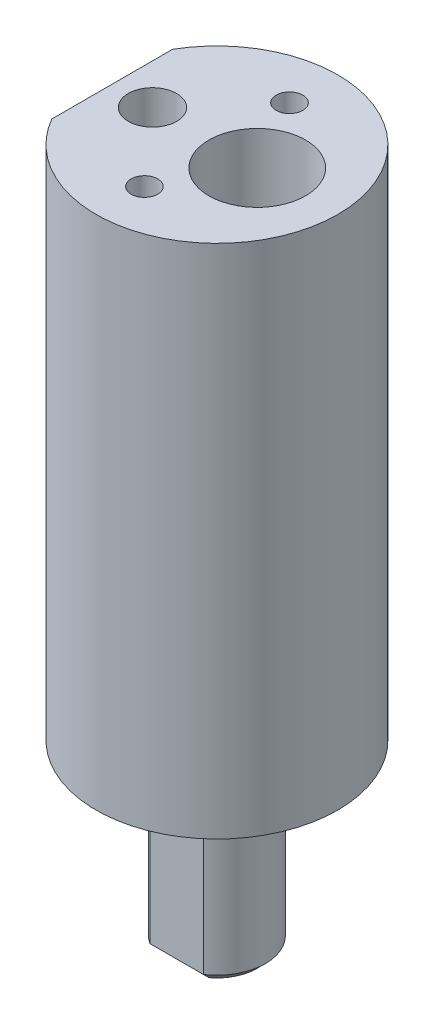
from build123d import *

# Parameters (mm, degrees)
BOSS_EXTRUDE1_DEPTH     = 22
BOSS_EXTRUDE2_DEPTH     = 64
SKETCH3_R               = 3
CUT_EXTRUDE1_DEPTH      = 65
SKETCH4_R               = 6
CUT_EXTRUDE2_DEPTH      = 52
M4_TAPPED_HOLE1_D       = 3.3
M4_TAPPED_HOLE1_DEPTH   = 14
M4_TAPPED_HOLE1_TIP     = 0.991420021
CUT_EXTRUDE3_REACH      = 93.679
CUT_EXTRUDE3_END_RADIUS = 3
SKETCH8_R               = 2.5
SKETCH8_R_2             = 1.5
SKETCH9_R               = 1
CUT_EXTRUDE4_DEPTH      = 15
CHAMFER1_SIZE           = 1


with BuildPart() as part:
    # Sketch1 → Boss-Extrude1 (new body)
    with BuildSketch(Plane(origin=(0, 0, 0), x_dir=(1, 0, 0), z_dir=(0, 1, 0))):
        with BuildLine():
            Line((-3.31662479, -5), (3.31662479, -5))
            ThreePointArc((3.31662479, -5), (0, 6), (-3.31662479, -5))
        make_face()
    extrude(amount=BOSS_EXTRUDE1_DEPTH)

    # Sketch2 → Boss-Extrude2 (add)
    with BuildSketch(Plane(origin=(0, 22, 0), x_dir=(1, 0, 0), z_dir=(0, 1, 0))):
        with BuildLine():
            Line((-13, 7.483314774), (-13, -7.483314774))
            ThreePointArc((-13, -7.483314774), (15, 0), (-13, 7.483314774))
        make_face()
    extrude(amount=BOSS_EXTRUDE2_DEPTH)

    # Sketch3 → Cut-Extrude1 (cut)
    with BuildSketch(Plane(origin=(0, 86, 0), x_dir=(1, 0, 0), z_dir=(0, 1, 0))):
        with Locations(Location((-8, 0, 0), (0, 0, 270))):
            Circle(SKETCH3_R)
    extrude(amount=-CUT_EXTRUDE1_DEPTH, mode=Mode.SUBTRACT)

    # Sketch4 → Cut-Extrude2 (cut)
    with BuildSketch(Plane(origin=(0, 86, 0), x_dir=(1, 0, 0), z_dir=(0, 1, 0))):
        with Locations(Location((5, 0, 0), (0, 0, 270))):
            Circle(SKETCH4_R)
    extrude(amount=-CUT_EXTRUDE2_DEPTH, mode=Mode.SUBTRACT)

    # M4 Tapped Hole1
    with Locations(Plane(origin=(0, 86, 0), x_dir=(1, 0, 0), z_dir=(0, 1, 0))):
        with Locations((0, 9), (0, -9)):
            Hole(M4_TAPPED_HOLE1_D / 2, depth=M4_TAPPED_HOLE1_DEPTH)
            with Locations((0, 0, -(M4_TAPPED_HOLE1_DEPTH + M4_TAPPED_HOLE1_TIP / 2))):  # 118° drill point
                Cone(0, M4_TAPPED_HOLE1_D / 2, M4_TAPPED_HOLE1_TIP, mode=Mode.SUBTRACT)

    # Cut-Extrude3: up to this cylinder (the profile starts outside it)
    cut_extrude3_end = Plane(origin=(-8, 39.5, 0), z_dir=(0, 1, 0)) * Cylinder(CUT_EXTRUDE3_END_RADIUS, 223.358, mode=Mode.PRIVATE)
    # Sketch8 → Cut-Extrude3 (cut, up to the surface)
    with BuildSketch(Plane.ZY.offset(13), mode=Mode.PRIVATE) as cut_extrude3_sk1:
        with Locations((0, 54)):
            Circle(SKETCH8_R)
    cut_extrude3_tool1 = extrude(cut_extrude3_sk1.sketch, amount=-CUT_EXTRUDE3_REACH, mode=Mode.PRIVATE) - cut_extrude3_end
    add(cut_extrude3_tool1.solids().sort_by_distance((-13, 54, 0))[0], mode=Mode.SUBTRACT)
    # Sketch8 → Cut-Extrude3 (cut, up to the surface)
    with BuildSketch(Plane.ZY.offset(13), mode=Mode.PRIVATE) as cut_extrude3_sk2:
        with Locations((0, 25)):
            Circle(SKETCH8_R_2)
    cut_extrude3_tool2 = extrude(cut_extrude3_sk2.sketch, amount=-CUT_EXTRUDE3_REACH, mode=Mode.PRIVATE) - cut_extrude3_end
    add(cut_extrude3_tool2.solids().sort_by_distance((-13, 25, 0))[0], mode=Mode.SUBTRACT)

    # Sketch9 → Cut-Extrude4 (cut)
    with BuildSketch(Plane.ZY.offset(13)):
        with Locations((0, 76)):
            Circle(SKETCH9_R)
        with Locations((0, 34)):
            Circle(SKETCH9_R)
    extrude(amount=-CUT_EXTRUDE4_DEPTH, mode=Mode.SUBTRACT)

    # Chamfer1
    chamfer1_edges = [part.edges().sort_by_distance(p)[0] for p in [
        (0, 0, 5),
        (0, 0, -6),
    ]]
    chamfer(chamfer1_edges, length=CHAMFER1_SIZE - 0.0001)  # a hair under: the kernel refuses the full size


solid = part.part
